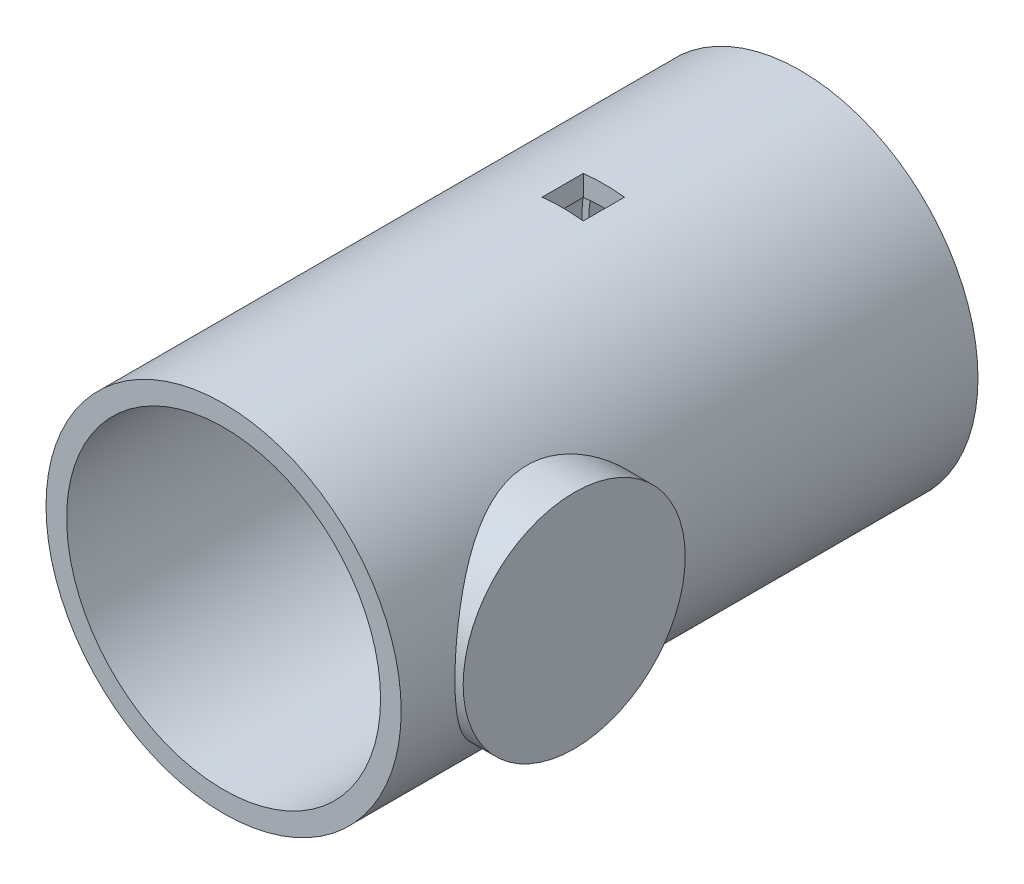
from build123d import *

# Parameters (mm, degrees)
SKETCH1_R           = 43.1
BOSS_EXTRUDE1_DEPTH = 140
SKETCH6_W           = 10
SKETCH6_H           = 10
CUT_EXTRUDE3_DEPTH  = 170.964849307
SKETCH8_R           = 26.95
BOSS_EXTRUDE2_DEPTH = 20
SKETCH5_R           = 31.75
CUT_EXTRUDE4_DEPTH  = 154.269762333
SKETCH2_R           = 38.1
CUT_EXTRUDE5_DEPTH  = 135
BOSS_EXTRUDE3_START = 10
SKETCH9_R           = 38.1
SKETCH9_R_2         = 36.44
BOSS_EXTRUDE3_DEPTH = 10


with BuildPart() as part:
    # Sketch1 → Boss-Extrude1 (new body)
    with BuildSketch(Plane.XY):
        Circle(SKETCH1_R)
    extrude(amount=BOSS_EXTRUDE1_DEPTH)

    # Sketch6 → Cut-Extrude3 (cut, through all)
    with BuildSketch(Plane(origin=(0, 43.1, 0), x_dir=(1, 0, 0), z_dir=(0, 1, 0))):
        with Locations((0, -52.7)):
            Rectangle(SKETCH6_W, SKETCH6_H)
    extrude(amount=-CUT_EXTRUDE3_DEPTH, mode=Mode.SUBTRACT)

    # Sketch8 → Boss-Extrude2 (add)
    with BuildSketch(Plane(origin=(45.1, 0, 0), x_dir=(0, 0, -1), z_dir=(1, 0, 0))):
        with Locations((-100, 0)):
            Circle(SKETCH8_R)
    extrude(amount=-BOSS_EXTRUDE2_DEPTH)

    # Sketch5 → Cut-Extrude4 (cut, through all)
    with BuildSketch(Plane.XY.offset(140)):
        Circle(SKETCH5_R)
    extrude(amount=-CUT_EXTRUDE4_DEPTH, mode=Mode.SUBTRACT)

    # Sketch2 → Cut-Extrude5 (cut)
    with BuildSketch(Plane.XY.offset(140)):
        Circle(SKETCH2_R)
    extrude(amount=-CUT_EXTRUDE5_DEPTH, mode=Mode.SUBTRACT)

    # Sketch9 → Boss-Extrude3 (add)
    with BuildSketch(Plane.XY.offset(5).offset(BOSS_EXTRUDE3_START)):
        Circle(SKETCH9_R)
        Circle(SKETCH9_R_2, mode=Mode.SUBTRACT)
    extrude(amount=-BOSS_EXTRUDE3_DEPTH)


solid = part.part
